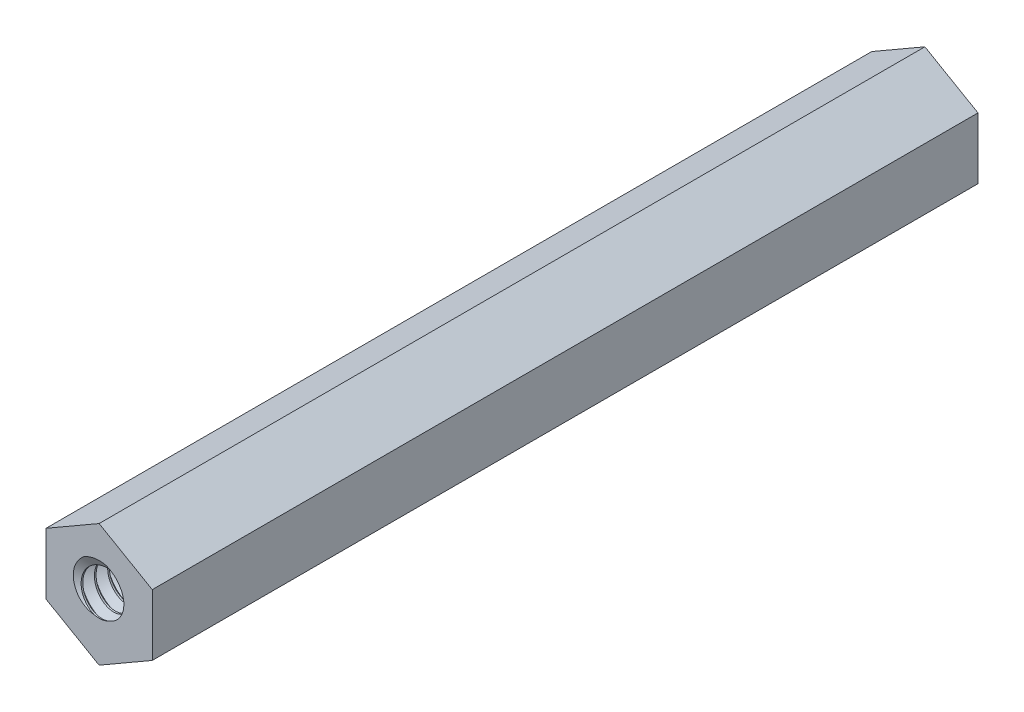
from build123d import *

# Parameters (mm, degrees)
EXTRUDE1_DEPTH          = 28.575
EXTRUDE1_DEPTH_BACK     = 28.575
SKETCH1_R               = 1.7526
SWEEP1_PITCH            = 0.79375
EXTRUDE2_DEPTH          = 59.146709108
SKETCH8_OUTSIDE_W       = 224.99
SKETCH8_OUTSIDE_H       = 225.972
SKETCH8_OUTSIDE_R       = 3.175
EXTRUDE4_DEPTH          = 59.146709108
EXTRUDE4_DRAFT          = -60
MIRROR1_COPY_1_SKETCH_W = 224.99
MIRROR1_COPY_1_SKETCH_H = 225.972
MIRROR1_COPY_1_SKETCH_R = 3.175
MIRROR1_COPY_1_DEPTH    = 59.146709108
MIRROR1_COPY_1_DRAFT    = -60
SKETCH9_W               = 38.1
SKETCH9_H               = 1.8034
SKETCH13_R              = 3.666174209
CUT_EXTRUDE1_DEPTH      = 3.900000046


with BuildPart() as part:
    # Sketch1 → Extrude1 (new, two sides: drawn at the far end of the back side and taken through both)
    with BuildSketch(Plane.XY.offset(-EXTRUDE1_DEPTH_BACK)):
        Polygon((0, 3.666174209), (-3.175, 1.833087105), (-3.175, -1.833087105), (0, -3.666174209), (3.175, -1.833087105), (3.175, 1.833087105), align=None)
        Circle(SKETCH1_R, mode=Mode.SUBTRACT)
    extrude(amount=EXTRUDE1_DEPTH + EXTRUDE1_DEPTH_BACK)

    # Sweep1: arcs per turn and ends read off the stored shape
    # Sweep1: the profile of Sketch12 profile screwed along a right-hand helix through 73 turns, 6 arcs to a turn; built about Z, then put on its axis
    sweep1_z = Axis((0, 0, 0), (0, 0, 1))
    sweep1_corners = [(1.7532, 0, -0.69487766), (1.7532, 0, 0.00034641), (1.237044252, 0, -0.29765625), (1.237044252, 0, -0.396875)]
    with BuildLine(mode=Mode.PRIVATE) as sweep1_profile:
        Line(sweep1_corners[0], sweep1_corners[1])
        Line(sweep1_corners[1], sweep1_corners[2])
        Line(sweep1_corners[2], sweep1_corners[3])
        Line(sweep1_corners[3], sweep1_corners[0])
    sweep1_cap = Face(sweep1_profile.wire())
    sweep1_turn_angles = [0, 30, 60, 90, 120, 150, 180, 210, 240, 270, 300, 330, 360]
    sweep1_turn_weights = [1, 0.8660254037844387, 1, 0.8660254037844387, 1, 0.8660254037844387, 1, 0.8660254037844387, 1, 0.8660254037844387, 1, 0.8660254037844387, 1]
    sweep1_turn_rails = [Edge.make_bspline([Vector(p[0], p[1], 0).rotate(sweep1_z, sweep1_turn_angles[k]) / sweep1_turn_weights[k] + Vector(0, 0, p[2] + SWEEP1_PITCH * sweep1_turn_angles[k] / 360) for k in range(13)], [0, 0, 0, 1, 1, 2, 2, 3, 3, 4, 4, 5, 5, 6, 6, 6], 2, sweep1_turn_weights) for p in sweep1_corners]
    sweep1_turn_sides = [Face.make_surface_from_curves(sweep1_turn_rails[p[0]], sweep1_turn_rails[p[1]]) for p in [(0, 1), (1, 2), (2, 3), (3, 0)]]
    sweep1 = Plane(origin=(0, 0, -28.575), x_dir=(0, 1, 0), z_dir=(0, 0, 1)) * Solid(Shell([*[p.moved(Location((0, 0, SWEEP1_PITCH * i))) for i in range(73) for p in sweep1_turn_sides], sweep1_cap, sweep1_cap.rotate(sweep1_z, 26280).moved(Location((0, 0, SWEEP1_PITCH * 26280 / 360)))]))
    add(sweep1)

    # Sketch6 → Extrude2 (cut, through all)
    with BuildSketch(Plane(origin=(0, 0, -28.575), x_dir=(-1, 0, 0), z_dir=(0, 0, -1))):
        Polygon((0, 3.666174209), (-3.175, 1.833087105), (-3.175, -1.833087105), (0, -3.666174209), (3.175, -1.833087105), (3.175, 1.833087105), align=None)
    extrude2 = extrude(amount=EXTRUDE2_DEPTH, mode=Mode.SUBTRACT)

    # Extrude3 cone 1 section (through the dimple's axis) → Extrude3 (revolve, cut)
    with BuildSketch(Plane(origin=(0, 0, -28.575), x_dir=(0, 1, 0), z_dir=(1, 0, 0))):
        Polygon((0, 0), (1.8034, 0), (0, 1.933909732), align=None)
    extrude3 = revolve(axis=Axis((0, 0, -28.575), (0, 0, 1)), mode=Mode.SUBTRACT)


with BuildPart() as extrude4_tool:
    # Sketch8 outside → Extrude4 (with draft: the straight prism first)
    with BuildSketch(Plane(origin=(0, 0, -28.575), x_dir=(-1, 0, 0), z_dir=(0, 0, -1))):
        Rectangle(SKETCH8_OUTSIDE_W, SKETCH8_OUTSIDE_H)
        Circle(SKETCH8_OUTSIDE_R, mode=Mode.SUBTRACT)
    extrude(amount=-EXTRUDE4_DEPTH)
    # Extrude4: the draft: its side faces are tilted about the plane it starts from
    extrude4_sides = [extrude4_tool.faces().sort_by_distance(p)[0] for p in [
        (0, -112.986, 0.998354554),
        (-112.495, 0, 0.998354554),
        (0, 112.986, 0.998354554),
        (112.495, 0, 0.998354554),
        (3.175, 0, 0.998354554),
    ]]
    draft(extrude4_sides, Plane(origin=(0, 0, -28.575), x_dir=(-1, 0, 0), z_dir=(0, 0, -1)), EXTRUDE4_DRAFT)


with BuildPart() as part_1:
    add(part.part)

    # Extrude4: cut by extrude4_tool
    add(extrude4_tool.part, mode=Mode.SUBTRACT)

    # Mirror1: Extrude2, Extrude3 across plane
    add(extrude2.mirror(Plane.XY), mode=Mode.SUBTRACT)
    add(extrude3.mirror(Plane.XY), mode=Mode.SUBTRACT)


with BuildPart() as mirror1_copy_1_tool:
    # Mirror1 copy 1 sketch → Mirror1 copy 1 (with draft: the straight prism first)
    with BuildSketch(Plane(origin=(0, 0, 28.575), x_dir=(-1, 0, 0), z_dir=(0, 0, 1))):
        Rectangle(MIRROR1_COPY_1_SKETCH_W, MIRROR1_COPY_1_SKETCH_H)
        Circle(MIRROR1_COPY_1_SKETCH_R, mode=Mode.SUBTRACT)
    extrude(amount=-MIRROR1_COPY_1_DEPTH)
    # Mirror1 copy 1: the draft: its side faces are tilted about the plane it starts from
    mirror1_copy_1_sides = [mirror1_copy_1_tool.faces().sort_by_distance(p)[0] for p in [
        (0, -112.986, -0.998354554),
        (-112.495, 0, -0.998354554),
        (0, 112.986, -0.998354554),
        (112.495, 0, -0.998354554),
        (3.175, 0, -0.998354554),
    ]]
    draft(mirror1_copy_1_sides, Plane(origin=(0, 0, 28.575), x_dir=(-1, 0, 0), z_dir=(0, 0, 1)), MIRROR1_COPY_1_DRAFT)


with BuildPart() as part_2:
    add(part_1.part)

    # Mirror1 copy 1: cut by mirror1_copy_1_tool
    add(mirror1_copy_1_tool.part, mode=Mode.SUBTRACT)

    # Sketch9 → Revolve 2 (revolve)
    with BuildSketch(Plane(origin=(0, 0, 0), x_dir=(0, 0, -1), z_dir=(1, 0, 0))):
        with Locations((0, 0.9017)):
            Rectangle(SKETCH9_W, SKETCH9_H)
    revolve(axis=Axis((0, 0, 28.575), (0, 0, -1)))

    # Sketch13 → Cut-Extrude1 (cut)
    with BuildSketch(Plane.XY.offset(28.575)):
        Circle(SKETCH13_R)
    cut_extrude1 = extrude(amount=-CUT_EXTRUDE1_DEPTH, mode=Mode.SUBTRACT)

    # Mirror2: Cut-Extrude1 across plane
    add(cut_extrude1.mirror(Plane.XY), mode=Mode.SUBTRACT)


solid = part_2.part
